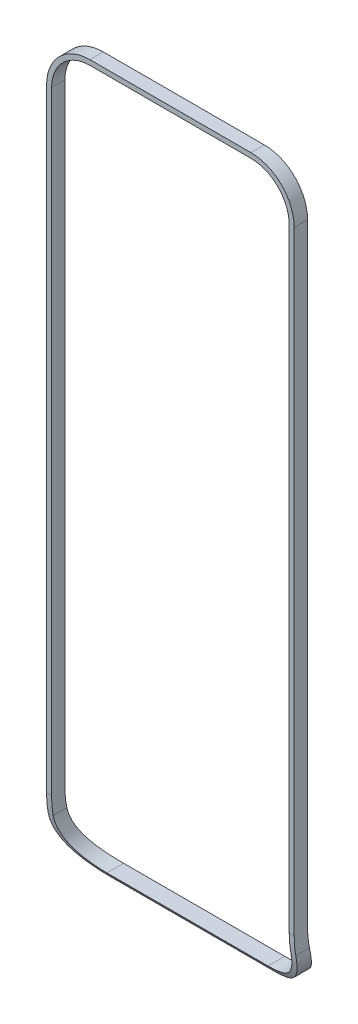
from build123d import *

# Parameters (mm, degrees)
BOSS_EXTRUDE1_DEPTH     = 100
CUT_EXTRUDE1_DEPTH      = 1971.463143527
CUT_EXTRUDE1_DEPTH_BACK = 1971.463143527


with BuildPart() as part:
    # Sketch1 → Boss-Extrude1 (new body)
    with BuildSketch(Plane.XY):
        with BuildLine():
            Line((-13, 100), (-13, 1750))
            ThreePointArc((-13, 1750), (20.096933726, 1829.903066274), (100, 1863))
            Line((100, 1863), (521, 1863))
            ThreePointArc((521, 1863), (600.903066274, 1829.903066274), (634, 1750))
            Line((634, 1750), (634, 100))
            ThreePointArc((634, 100), (600.903066274, 20.096933726), (521, -13))
            Line((521, -13), (100, -13))
            ThreePointArc((100, -13), (20.096933726, 20.096933726), (-13, 100))
        make_face()
        with BuildLine():
            Line((100, 0), (521, 0))
            ThreePointArc((521, 0), (591.710678119, 29.289321881), (621, 100))
            Line((621, 100), (621, 1750))
            ThreePointArc((621, 1750), (591.710678119, 1820.710678119), (521, 1850))
            Line((521, 1850), (100, 1850))
            ThreePointArc((100, 1850), (29.289321881, 1820.710678119), (0, 1750))
            Line((0, 1750), (0, 100))
            ThreePointArc((0, 100), (29.289321881, 29.289321881), (100, 0))
        make_face(mode=Mode.SUBTRACT)
    extrude(amount=-BOSS_EXTRUDE1_DEPTH)

    # Sketch2 → Cut-Extrude1 (cut, two sides: drawn at the far end of the back side and taken through both)
    with BuildSketch(Plane(origin=(0, 0, 0), x_dir=(0, 0, -1), z_dir=(1, 0, 0)).offset(-CUT_EXTRUDE1_DEPTH_BACK)):
        with BuildLine():
            Line((100, 1863), (35, 1863))
            Line((35, 1863), (35, 147.120579564))
            ThreePointArc((35, 147.120579564), (51.869398873, 60.715139921), (100, -13))
            Line((100, -13), (100, 1863))
        make_face()
        with BuildLine():
            Line((0, 147.120579564), (0, -13))
            Line((0, -13), (53.916588263, -13))
            ThreePointArc((53.916588263, -13), (13.84098777, 62.643365936), (0, 147.120579564))
        make_face()
    extrude(amount=CUT_EXTRUDE1_DEPTH + CUT_EXTRUDE1_DEPTH_BACK, mode=Mode.SUBTRACT)


solid = part.part
